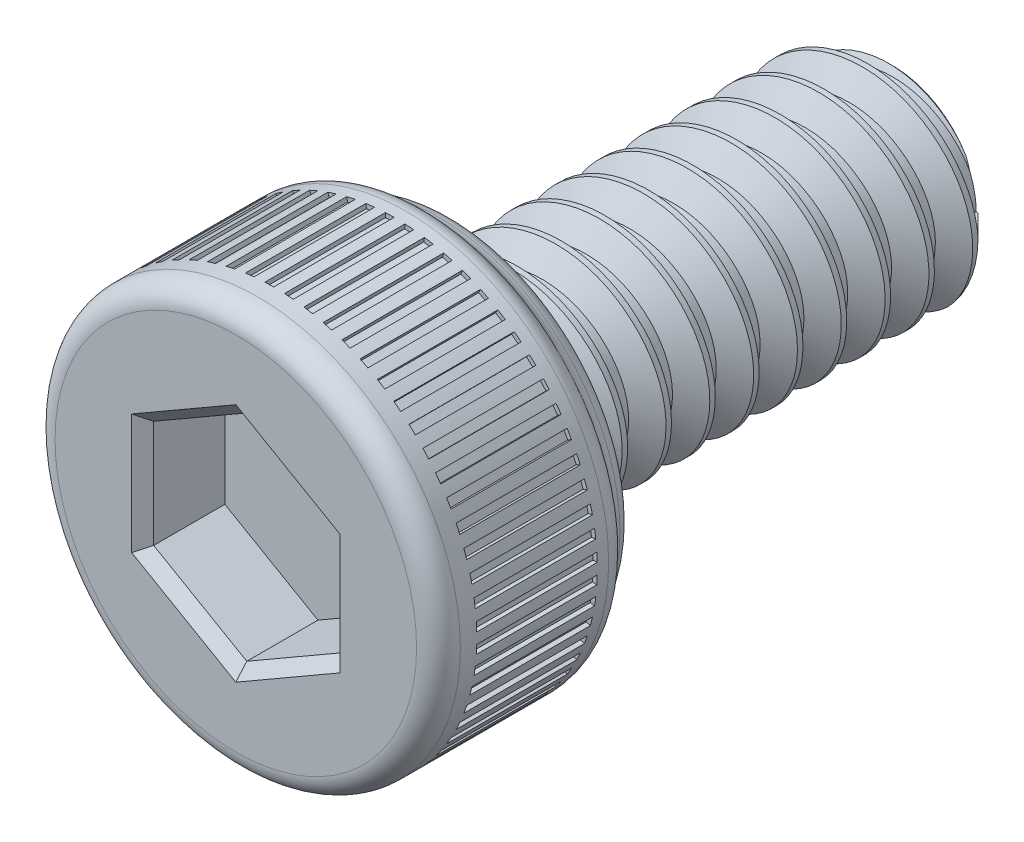
from build123d import *

# Parameters (mm, degrees)
CUT_EXTRUDE1_DEPTH = 0.75
THREAD1_PITCH      = 0.4
FILLET1_R          = 0.2
CHAMFER1_SIZE      = 0.1
FILLET2_R          = 0.2
SKETCH6_W          = 0.08
SKETCH6_H          = 0.069814446
CUT_EXTRUDE2_DEPTH = 1.1
CIRPATTERN1_COUNT  = 65


with BuildPart() as part:
    # Sketch2 → Revolve1 (revolve)
    with BuildSketch(Plane.YZ, mode=Mode.PRIVATE) as revolve1_sk:
        Polygon((0, 0), (1.85, 0), (1.85, -1.7), (1.65, -1.7), (1.65, -2), (0.975, -2), (0.975, -5.8), (0.775, -6), (0, -6), (0, -5.8), align=None)
    revolve(revolve1_sk.sketch.rotate(Axis((0, 0, -5.8), (0, 0, 1)), 90), axis=Axis((0, 0, -5.8), (0, 0, 1)))

    # Sketch3 → Cut-Extrude1 (cut)
    with BuildSketch(Plane.XY):
        Polygon((0.85, 0.490747729), (0, 0.981495458), (-0.85, 0.490747729), (-0.85, -0.490747729), (0, -0.981495458), (0.85, -0.490747729), align=None)
    extrude(amount=-CUT_EXTRUDE1_DEPTH, mode=Mode.SUBTRACT)

    # Thread1: the profile of Thread Profile1 profile screwed along a right-hand helix of 9.5 turns, 6 arcs to a turn; built about Z, then put on its axis
    thread1_z = Axis((0, 0, 0), (0, 0, 1))
    thread1_corners = [(0.9753, 0, -0.000173205), (0.9753, 0, 0.350173204), (0.75849365, 0, 0.224999999), (0.75849365, 0, 0.124999999)]
    with BuildLine(mode=Mode.PRIVATE) as thread1_profile:
        Line(thread1_corners[0], thread1_corners[1])
        Line(thread1_corners[1], thread1_corners[2])
        Line(thread1_corners[2], thread1_corners[3])
        Line(thread1_corners[3], thread1_corners[0])
    thread1_cap = Face(thread1_profile.wire())
    thread1_turn_angles = [0, 30, 60, 90, 120, 150, 180, 210, 240, 270, 300, 330, 360]
    thread1_turn_weights = [1, 0.8660254037844387, 1, 0.8660254037844387, 1, 0.8660254037844387, 1, 0.8660254037844387, 1, 0.8660254037844387, 1, 0.8660254037844387, 1]
    thread1_turn_rails = [Edge.make_bspline([Vector(p[0], p[1], 0).rotate(thread1_z, thread1_turn_angles[k]) / thread1_turn_weights[k] + Vector(0, 0, p[2] + THREAD1_PITCH * thread1_turn_angles[k] / 360) for k in range(13)], [0, 0, 0, 1, 1, 2, 2, 3, 3, 4, 4, 5, 5, 6, 6, 6], 2, thread1_turn_weights) for p in thread1_corners]
    thread1_turn_sides = [Face.make_surface_from_curves(thread1_turn_rails[p[0]], thread1_turn_rails[p[1]]) for p in [(0, 1), (1, 2), (2, 3), (3, 0)]]
    thread1_last_angles = [3240, 3270, 3300, 3330, 3360, 3390, 3420]
    thread1_last_weights = [1, 0.8660254037844387, 1, 0.8660254037844387, 1, 0.8660254037844387, 1]
    thread1_last_rails = [Edge.make_bspline([Vector(p[0], p[1], 0).rotate(thread1_z, thread1_last_angles[k]) / thread1_last_weights[k] + Vector(0, 0, p[2] + THREAD1_PITCH * thread1_last_angles[k] / 360) for k in range(7)], [0, 0, 0, 1, 1, 2, 2, 3, 3, 3], 2, thread1_last_weights) for p in thread1_corners]
    thread1_last_sides = [Face.make_surface_from_curves(thread1_last_rails[p[0]], thread1_last_rails[p[1]]) for p in [(0, 1), (1, 2), (2, 3), (3, 0)]]
    thread1 = Plane(origin=(0, 0, -2), x_dir=(-1, 0, 0), z_dir=(0, 0, -1)) * Solid(Shell([*[p.moved(Location((0, 0, THREAD1_PITCH * i))) for i in range(9) for p in thread1_turn_sides], *thread1_last_sides, thread1_cap, thread1_cap.rotate(thread1_z, 3420).moved(Location((0, 0, THREAD1_PITCH * 3420 / 360)))]))
    add(thread1, mode=Mode.SUBTRACT)

    # Fillet1
    fillet1_edges = [part.edges().sort_by_distance(p)[0] for p in [
        (1.65, 0, -1.7),
        (1.85, 0, 0),
    ]]
    fillet(fillet1_edges, radius=FILLET1_R - 0.0001)  # a hair under: the kernel refuses the full size

    # Chamfer1
    chamfer1_edges = [part.edges().sort_by_distance(p)[0] for p in [
        (0.85, 0, 0),
        (0.425, 0.736121593, 0),
        (-0.425, 0.736121593, 0),
        (-0.85, 0, 0),
        (-0.425, -0.736121593, 0),
        (0.425, -0.736121593, 0),
    ]]
    chamfer(chamfer1_edges, length=CHAMFER1_SIZE)

    # Fillet2
    fillet2_edges = [part.edges().sort_by_distance(p)[0] for p in [
        (1.65, 0, -2),
        (1.85, 0, -1.7),
    ]]
    fillet(fillet2_edges, radius=FILLET2_R)

    # Sketch6 → Cut-Extrude2 (cut)
    with BuildSketch(Plane(origin=(0, 0, -0.35), x_dir=(0, -1, 0), z_dir=(0, 0, 1))):
        with Locations((0, -1.844907223)):
            Rectangle(SKETCH6_W, SKETCH6_H)
    cut_extrude2 = extrude(amount=-CUT_EXTRUDE2_DEPTH, mode=Mode.SUBTRACT)

    # CirPattern1: Cut-Extrude2 ×65 about axis
    cirpattern1_axis = Axis((0, 0, 0), (0, 0, 1))
    for i in range(1, CIRPATTERN1_COUNT):
        add(cut_extrude2.rotate(cirpattern1_axis, i * 360 / CIRPATTERN1_COUNT), mode=Mode.SUBTRACT)


solid = part.part
